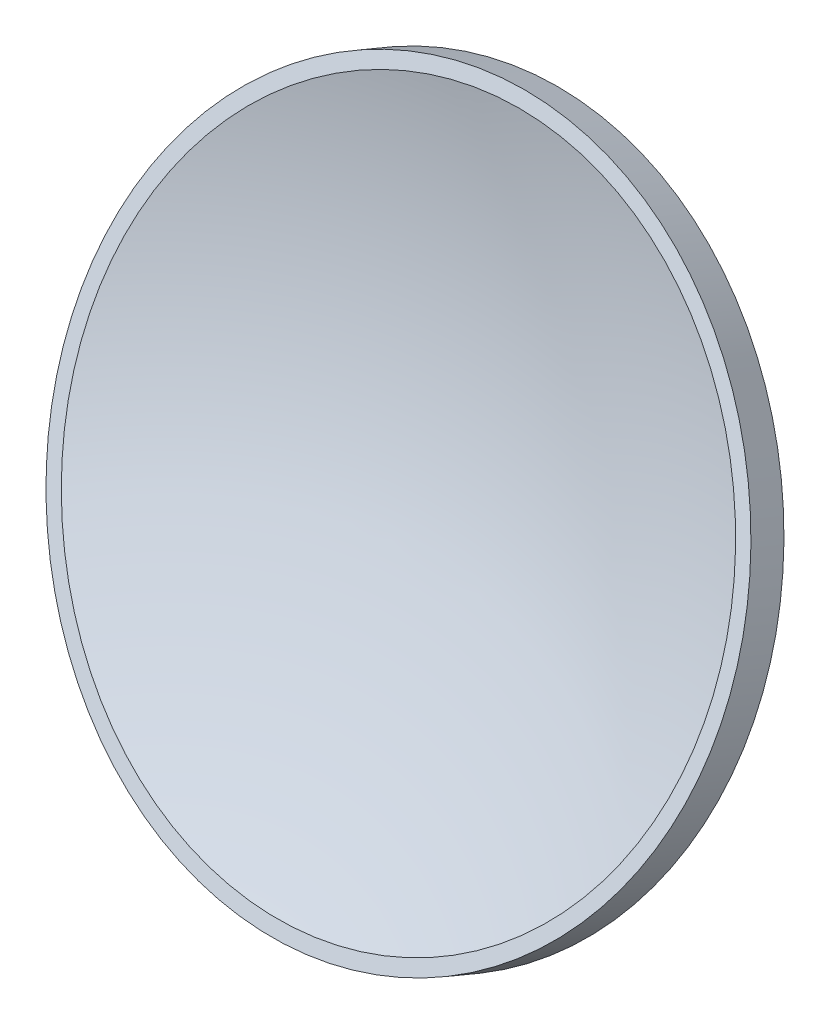
from build123d import *


with BuildPart() as part:
    # Esquisse1 → Révolution1 (revolve)
    with BuildSketch(Plane(origin=(0, -1.422218517, 0.591043356), x_dir=(1, 0, 0), z_dir=(0, -0.9234332960375348, 0.3837589709300026))):
        with BuildLine():
            Line((0, 5.655762448), (0, 0))
            ThreePointArc((0, 0), (23.186969506, 2.261457266), (45.5, 8.960592581))
            Line((45.5, 8.960592581), (46, 9.460592581))
            Line((46, 9.460592581), (46, 14.460592581))
            Line((46, 14.460592581), (44.000433441, 14.460592581))
            ThreePointArc((44.000433441, 14.460592581), (22.436372126, 7.878575342), (0, 5.655762448))
        make_face()
    revolve(axis=Axis((0, 44.628857994, 111.403038881), (0, -0.3837589709300026, -0.9234332960375348)))


solid = part.part
